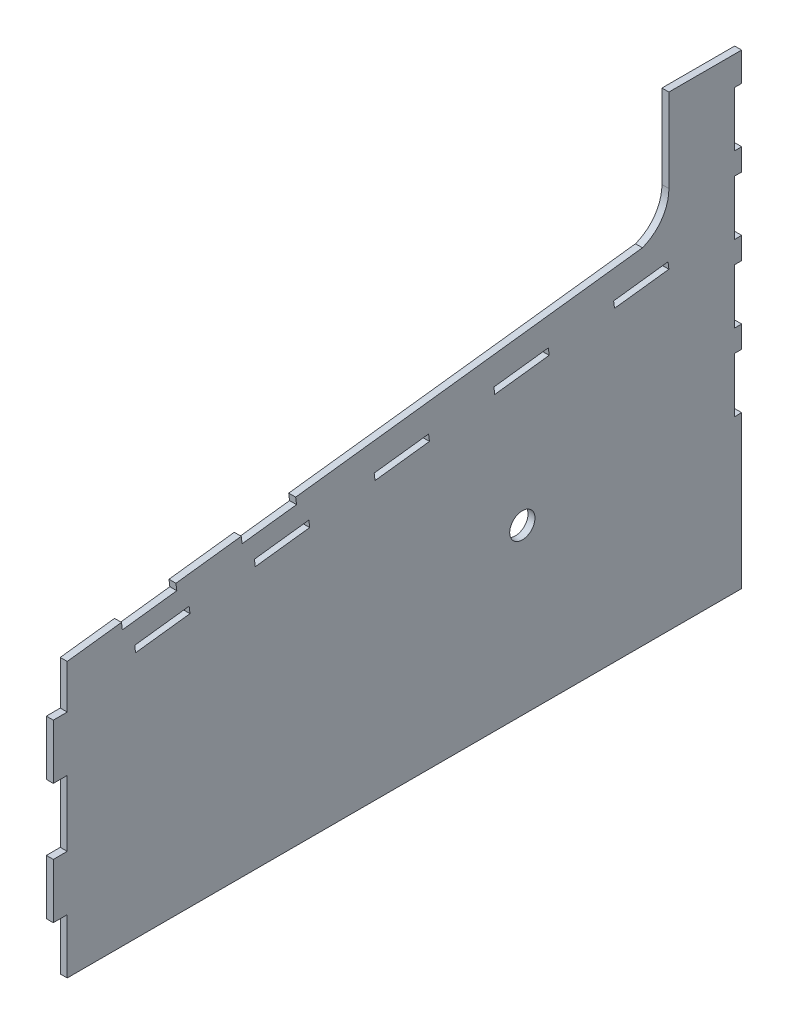
from build123d import *

# Parameters (mm, degrees)
BOSS_EXTRUDE1_DEPTH = 6.35
SKETCH2_R           = 11.5
CUT_EXTRUDE1_DEPTH  = 6.35


with BuildPart() as part:
    # Sketch1 → Boss-Extrude1 (new body)
    with BuildSketch(Plane(origin=(0, 0, 0), x_dir=(0, 0, -1), z_dir=(1, 0, 0))):
        with BuildLine():
            Line((0, 0), (615, 0))
            Line((615, 0), (615, 138.97))
            Line((615, 138.97), (608.65, 138.97))
            Line((608.65, 138.97), (608.65, 188.97))
            Line((608.65, 188.97), (615, 188.97))
            Line((615, 188.97), (615, 208.97))
            Line((615, 208.97), (608.65, 208.97))
            Line((608.65, 208.97), (608.65, 258.97))
            Line((608.65, 258.97), (615, 258.97))
            Line((615, 258.97), (615, 278.97))
            Line((615, 278.97), (608.65, 278.97))
            Line((608.65, 278.97), (608.65, 328.97))
            Line((608.65, 328.97), (615, 328.97))
            Line((615, 328.97), (615, 348.97))
            Line((615, 348.97), (608.65, 348.97))
            Line((608.65, 348.97), (608.65, 398.97))
            Line((608.65, 398.97), (615, 398.97))
            Line((615, 398.97), (615, 425.32))
            Line((615, 425.32), (548.65, 425.32))
            Line((548.65, 425.32), (548.65, 349.09))
            ThreePointArc((548.65, 349.09), (542.027292182, 327.966077076), (524.529993531, 314.404184936))
            Line((524.529993531, 314.404184936), (0, 250))
            Line((0, 250), (0, 210))
            Line((0, 210), (-12.7, 210))
            Line((-12.7, 210), (-12.7, 160))
            Line((-12.7, 160), (0, 160))
            Line((0, 160), (0, 100))
            Line((0, 100), (-12.7, 100))
            Line((-12.7, 100), (-12.7, 50))
            Line((-12.7, 50), (0, 50))
            Line((0, 50), (0, 0))
        make_face()
    extrude(amount=BOSS_EXTRUDE1_DEPTH)

    # Sketch2 → Cut-Extrude1 (cut)
    with BuildSketch(Plane(origin=(6.35, 0, 0), x_dir=(0, 0, -1), z_dir=(1, 0, 0))):
        with Locations((415, 150)):
            Circle(SKETCH2_R)
        Polygon((208.316848977, 275.57809283), (158.689541395, 269.48462566), (159.463411726, 263.181957597), (209.090719308, 269.275424767), align=None)
        Polygon((61.537861402, 231.965149724), (62.311731732, 225.662481662), (111.939039314, 231.755948832), (111.165168984, 238.058616895), align=None)
        Polygon((220.345245664, 251.464244669), (170.717938082, 245.370777499), (171.491808413, 239.068109436), (221.119115995, 245.161576606), align=None)
        Polygon((329.525322345, 264.869872444), (279.898014763, 258.776405274), (280.671885093, 252.473737211), (330.299192675, 258.567204381), align=None)
        Polygon((438.705399025, 278.275500218), (389.078091443, 272.182033048), (389.851961774, 265.879364985), (439.479269356, 271.972832155), align=None)
        Polygon((547.885475706, 291.681127993), (498.258168124, 285.587660823), (499.032038454, 279.28499276), (548.659346037, 285.37845993), align=None)
        Polygon((49.509464714, 256.078997886), (50.283335045, 249.776329823), (99.910642627, 255.869796993), (99.136772297, 262.172465056), align=None)
    extrude(amount=-CUT_EXTRUDE1_DEPTH, mode=Mode.SUBTRACT)


solid = part.part
